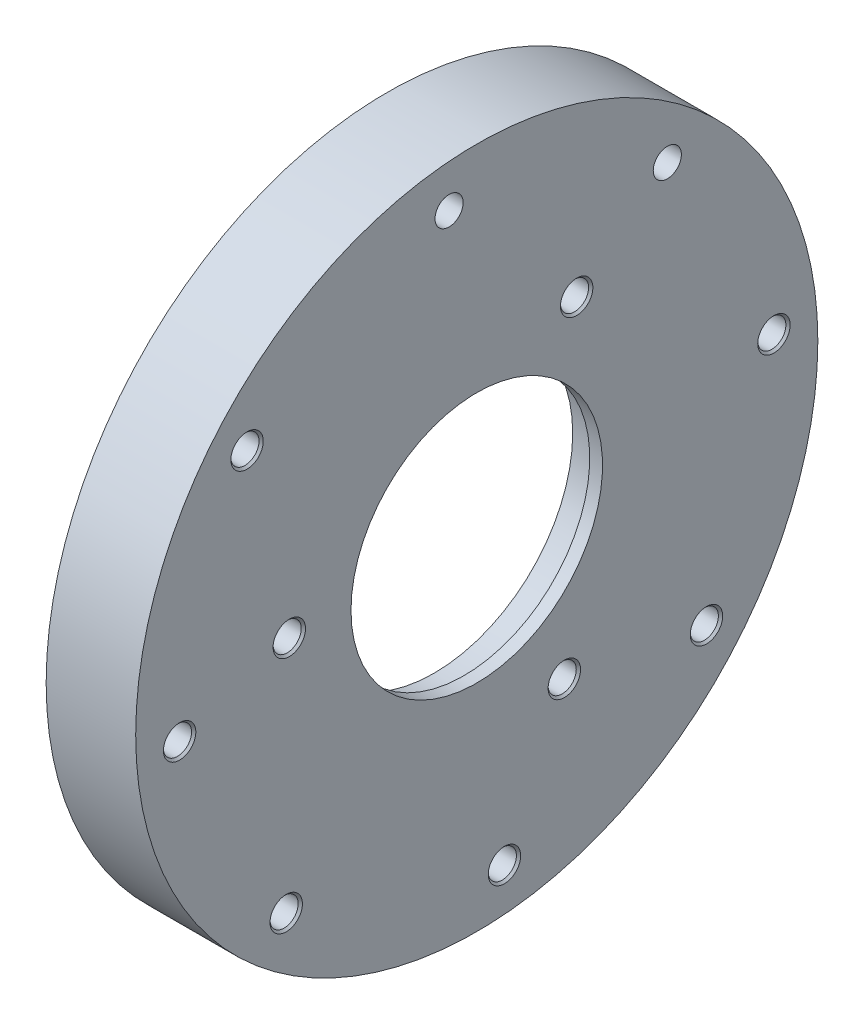
from build123d import *

# Parameters (mm, degrees)
SKETCH3_R          = 2.525
CUT_EXTRUDE1_DEPTH = 4
SKETCH6_R          = 3
CUT_EXTRUDE4_DEPTH = 11
SKETCH7_R          = 3.3
CUT_EXTRUDE5_DEPTH = 10
SKETCH9_R          = 1
CUT_EXTRUDE7_DEPTH = 2
CUT_EXTRUDE8_REACH = 117.07
SKETCH10_R         = 3.3
CHAMFER1_SIZE      = 0.5


with BuildPart() as part:
    # Sketch2 → Revolve1 (revolve)
    with BuildSketch(Plane.XY):
        Polygon((0, 80), (0, 52.5), (11, 52.5), (11, 32.5), (18, 32.5), (18, 29.5), (21, 29.5), (21, 80), align=None)
    revolve(axis=Axis((0, 0, 0), (1, 0, 0)))

    # Sketch3 → Cut-Extrude1 (cut)
    with BuildSketch(Plane.ZY):
        with Locations((0, 60)):
            Circle(SKETCH3_R)
        with Locations((12.077911205, 58.771796475)):
            Circle(SKETCH3_R)
        with Locations((23.661351307, 55.137468697)):
            Circle(SKETCH3_R)
        with Locations((34.276092906, 49.245806472)):
            Circle(SKETCH3_R)
        with Locations((43.487567234, 41.338015145)):
            Circle(SKETCH3_R)
        with Locations((50.91865545, 31.73784062)):
            Circle(SKETCH3_R)
        with Locations((56.265127929, 20.838315171)):
            Circle(SKETCH3_R)
        with Locations((59.30809946, 9.08566665)):
            Circle(SKETCH3_R)
        with Locations((59.92299043, -3.03895013)):
            Circle(SKETCH3_R)
        with Locations((58.084627132, -15.039151936)):
            Circle(SKETCH3_R)
        with Locations((53.868272374, -26.423649093)):
            Circle(SKETCH3_R)
        with Locations((47.446544216, -36.726358953)):
            Circle(SKETCH3_R)
        with Locations((39.082348963, -45.525487362)):
            Circle(SKETCH3_R)
        with Locations((29.118117752, -52.460796969)):
            Circle(SKETCH3_R)
        with Locations((17.961787378, -57.248355384)):
            Circle(SKETCH3_R)
        with Locations((6.070099319, -59.692159404)):
            Circle(SKETCH3_R)
        with Locations((-6.070099319, -59.692159404)):
            Circle(SKETCH3_R)
        with Locations((-17.961787378, -57.248355384)):
            Circle(SKETCH3_R)
        with Locations((-29.118117752, -52.460796969)):
            Circle(SKETCH3_R)
        with Locations((-39.082348963, -45.525487362)):
            Circle(SKETCH3_R)
        with Locations((-47.446544216, -36.726358953)):
            Circle(SKETCH3_R)
        with Locations((-53.868272374, -26.423649093)):
            Circle(SKETCH3_R)
        with Locations((-58.084627132, -15.039151936)):
            Circle(SKETCH3_R)
        with Locations((-59.92299043, -3.03895013)):
            Circle(SKETCH3_R)
        with Locations((-59.30809946, 9.08566665)):
            Circle(SKETCH3_R)
        with Locations((-56.265127929, 20.838315171)):
            Circle(SKETCH3_R)
        with Locations((-50.91865545, 31.73784062)):
            Circle(SKETCH3_R)
        with Locations((-43.487567234, 41.338015145)):
            Circle(SKETCH3_R)
        with Locations((-34.276092906, 49.245806472)):
            Circle(SKETCH3_R)
        with Locations((-23.661351307, 55.137468697)):
            Circle(SKETCH3_R)
        with Locations((-12.077911205, 58.771796475)):
            Circle(SKETCH3_R)
    extrude(amount=-CUT_EXTRUDE1_DEPTH, mode=Mode.SUBTRACT)

    # Sketch6 → Cut-Extrude4 (cut)
    with BuildSketch(Plane.ZY):
        with Locations((53.875586653, 44.692517973)):
            Circle(SKETCH6_R)
        with Locations((69.69817519, -6.493410136)):
            Circle(SKETCH6_R)
        with Locations((44.692517973, -53.875586653)):
            Circle(SKETCH6_R)
        with Locations((-6.493410136, -69.69817519)):
            Circle(SKETCH6_R)
        with Locations((-53.875586653, -44.692517973)):
            Circle(SKETCH6_R)
        with Locations((-69.69817519, 6.493410136)):
            Circle(SKETCH6_R)
        with Locations((-44.692517973, 53.875586653)):
            Circle(SKETCH6_R)
        with Locations((6.493410136, 69.69817519)):
            Circle(SKETCH6_R)
    extrude(amount=-CUT_EXTRUDE4_DEPTH, mode=Mode.SUBTRACT)

    # Sketch7 → Cut-Extrude5 (cut)
    with BuildSketch(Plane.ZY.offset(-21)):
        with Locations((53.875586653, 44.692517973)):
            Circle(SKETCH7_R)
        with Locations((69.69817519, -6.493410136)):
            Circle(SKETCH7_R)
        with Locations((44.692517973, -53.875586653)):
            Circle(SKETCH7_R)
        with Locations((-6.493410136, -69.69817519)):
            Circle(SKETCH7_R)
        with Locations((-53.875586653, -44.692517973)):
            Circle(SKETCH7_R)
        with Locations((-69.69817519, 6.493410136)):
            Circle(SKETCH7_R)
        with Locations((-44.692517973, 53.875586653)):
            Circle(SKETCH7_R)
        with Locations((6.493410136, 69.69817519)):
            Circle(SKETCH7_R)
    extrude(amount=CUT_EXTRUDE5_DEPTH, mode=Mode.SUBTRACT)

    # Sketch9 → Cut-Extrude7 (cut)
    with BuildSketch(Plane.ZY):
        with Locations((2.51770285, -71.46627686)):
            Circle(SKETCH9_R)
    extrude(amount=-CUT_EXTRUDE7_DEPTH, mode=Mode.SUBTRACT)

    # Sketch10 → Cut-Extrude8 (cut, up to next)
    with BuildSketch(Plane(origin=(21, 0, 0), x_dir=(0, 0, -1), z_dir=(1, 0, 0)), mode=Mode.PRIVATE) as cut_extrude8_sk1:
        with Locations((23.431880753, 37.241736861)):
            Circle(SKETCH10_R)
    cut_extrude8_tool1 = extrude(cut_extrude8_sk1.sketch, amount=-CUT_EXTRUDE8_REACH, mode=Mode.PRIVATE) & part.part
    # Sketch10 → Cut-Extrude8 (cut, up to next)
    with BuildSketch(Plane(origin=(21, 0, 0), x_dir=(0, 0, -1), z_dir=(1, 0, 0)), mode=Mode.PRIVATE) as cut_extrude8_sk2:
        with Locations((20.536349826, -38.913472421)):
            Circle(SKETCH10_R)
    cut_extrude8_tool2 = extrude(cut_extrude8_sk2.sketch, amount=-CUT_EXTRUDE8_REACH, mode=Mode.PRIVATE) & part.part
    # Sketch10 → Cut-Extrude8 (cut, up to next)
    with BuildSketch(Plane(origin=(21, 0, 0), x_dir=(0, 0, -1), z_dir=(1, 0, 0)), mode=Mode.PRIVATE) as cut_extrude8_sk3:
        with Locations((-43.968230579, 1.67173556)):
            Circle(SKETCH10_R)
    cut_extrude8_tool3 = extrude(cut_extrude8_sk3.sketch, amount=-CUT_EXTRUDE8_REACH, mode=Mode.PRIVATE) & part.part
    add(cut_extrude8_tool1.solids().sort_by_distance((21, 37.241737, -23.431881))[0], mode=Mode.SUBTRACT)
    add(cut_extrude8_tool2.solids().sort_by_distance((21, -38.913472, -20.53635))[0], mode=Mode.SUBTRACT)
    add(cut_extrude8_tool3.solids().sort_by_distance((21, 1.671736, 43.968231))[0], mode=Mode.SUBTRACT)

    # Chamfer1
    chamfer1_edges = [part.edges().sort_by_distance(p)[0] for p in [
        (21, -53.875586653, 41.392517973),
        (21, -69.69817519, -9.793410136),
        (21, -44.692517973, -57.175586653),
        (21, 6.493410136, -72.99817519),
        (21, 44.692517973, 50.575586653),
        (21, -6.493410136, 66.39817519),
        (21, 1.67173556, 47.268230579),
        (21, -38.913472421, -17.236349826),
        (21, 37.241736861, -20.131880753),
    ]]
    chamfer(chamfer1_edges, length=CHAMFER1_SIZE)


solid = part.part
